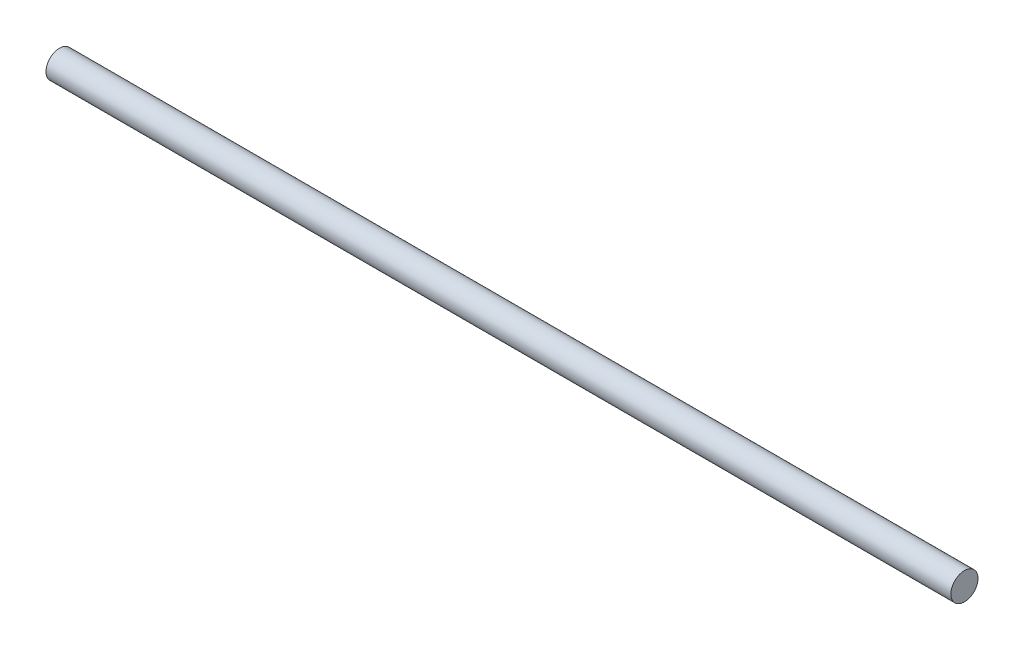
from build123d import *

# Parameters (mm, degrees)
SKETCH1_R           = 6
BOSS_EXTRUDE1_DEPTH = 400


with BuildPart() as part:
    # Sketch1 → Boss-Extrude1 (new body)
    with BuildSketch(Plane(origin=(0, 0, 0), x_dir=(0, 0, -1), z_dir=(1, 0, 0))):
        Circle(SKETCH1_R)
    extrude(amount=BOSS_EXTRUDE1_DEPTH)


solid = part.part
